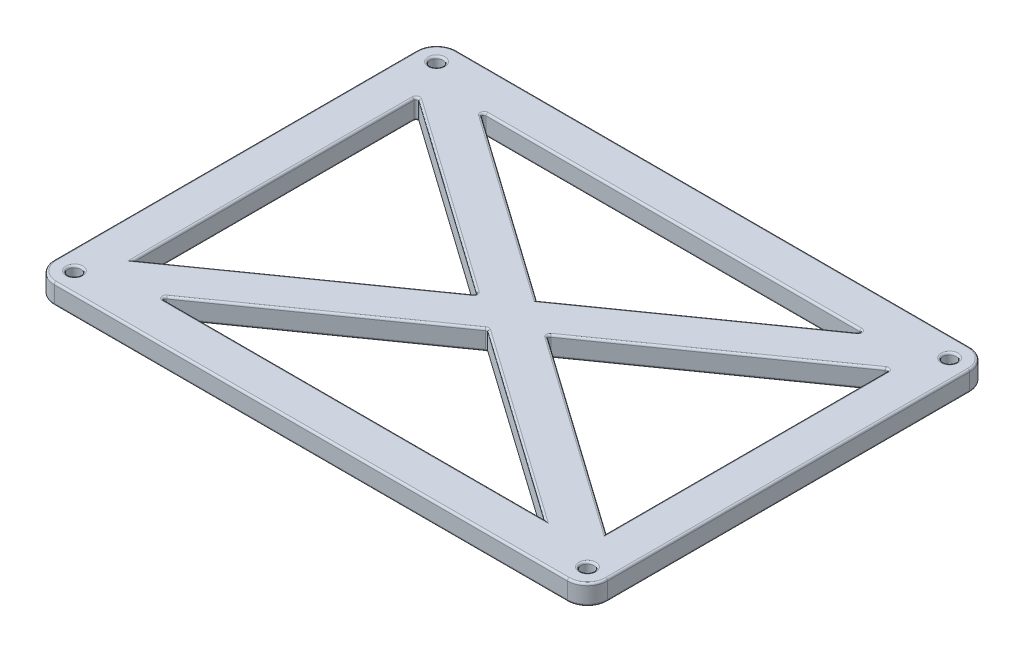
from build123d import *

# Parameters (mm, degrees)
SKETCH1_R           = 3.2
BOSS_EXTRUDE4_DEPTH = 10
FILLET1_R           = 1


with BuildPart() as part:
    # Sketch1 → Boss-Extrude4 (new body)
    with BuildSketch(Plane(origin=(0, 0, 0), x_dir=(1, 0, 0), z_dir=(0, 1, 0))):
        with BuildLine():
            Line((-255, 190), (0, 190))
            ThreePointArc((0, 190), (7.071067812, 187.071067812), (10, 180))
            Line((10, 180), (10, 0))
            ThreePointArc((10, 0), (7.071067812, -7.071067812), (0, -10))
            Line((0, -10), (-255, -10))
            ThreePointArc((-255, -10), (-262.071067812, -7.071067812), (-265, 0))
            Line((-265, 0), (-265, 180))
            ThreePointArc((-265, 180), (-262.071067812, 187.071067812), (-255, 190))
        make_face()
        with Locations((-255, 180)):
            Circle(SKETCH1_R, mode=Mode.SUBTRACT)
        with Locations((0, 180)):
            Circle(SKETCH1_R, mode=Mode.SUBTRACT)
        Circle(SKETCH1_R, mode=Mode.SUBTRACT)
        with Locations((-255, 0)):
            Circle(SKETCH1_R, mode=Mode.SUBTRACT)
        Polygon((-127.5, 77.759616443), (-31.507210039, 10), (-223.492789961, 10), align=None, mode=Mode.SUBTRACT)
        Polygon((-223.492789961, 170), (-127.5, 102.240383557), (-31.507210039, 170), align=None, mode=Mode.SUBTRACT)
        Polygon((-110.159456628, 90), (-10, 19.299207086), (-10, 160.700792914), align=None, mode=Mode.SUBTRACT)
        Polygon((-245, 160.700792914), (-144.840543372, 90), (-245, 19.299207086), align=None, mode=Mode.SUBTRACT)
    extrude(amount=BOSS_EXTRUDE4_DEPTH)

    # Fillet1
    fillet1_edges = [part.edges().sort_by_distance(p)[0] for p in [
        (-175.496394981, 0, -136.120191778),
        (-79.503605019, 0, -136.120191778),
        (-258.2, 0, 0),
        (-3.2, 0, 0),
        (-79.503605019, 0, -43.879808222),
        (-127.5, 0, -10),
        (-258.2, 0, -180),
        (-127.5, 0, 10),
        (7.071067812, 0, 7.071067812),
        (10, 0, -90),
        (7.071067812, 0, -187.071067812),
        (-127.5, 0, -190),
        (-262.071067812, 0, -187.071067812),
        (-265, 0, -90),
        (-262.071067812, 0, 7.071067812),
        (-245, 0, -90),
        (-194.920271686, 0, -54.649603543),
        (-3.2, 0, -180),
        (-10, 0, -90),
        (-60.079728314, 0, -54.649603543),
        (-175.496394981, 10, -136.120191778),
        (-79.503605019, 10, -136.120191778),
        (-10, 10, -90),
        (-60.079728314, 10, -54.649603543),
        (-258.2, 10, 0),
        (-79.503605019, 10, -43.879808222),
        (-127.5, 10, -10),
        (-3.2, 10, -180),
        (-265, 10, -90),
        (-262.071067812, 10, -187.071067812),
        (-127.5, 10, -190),
        (7.071067812, 10, -187.071067812),
        (10, 10, -90),
        (7.071067812, 10, 7.071067812),
        (-127.5, 10, 10),
        (-262.071067812, 10, 7.071067812),
        (-258.2, 10, -180),
        (-245, 10, -90),
        (-194.920271686, 10, -54.649603543),
        (-3.2, 10, 0),
        (-223.492789961, 5, -170),
        (-127.5, 10, -170),
        (-31.507210039, 5, -170),
        (-127.5, 0, -170),
        (-110.159456628, 5, -90),
        (-60.079728314, 10, -125.350396457),
        (-10, 5, -160.700792914),
        (-60.079728314, 0, -125.350396457),
        (-223.492789961, 5, -10),
        (-175.496394981, 10, -43.879808222),
        (-127.5, 5, -77.759616443),
        (-175.496394981, 0, -43.879808222),
        (-245, 5, -160.700792914),
        (-194.920271686, 10, -125.350396457),
        (-144.840543372, 5, -90),
        (-194.920271686, 0, -125.350396457),
    ]]
    fillet(fillet1_edges, radius=FILLET1_R)


solid = part.part
